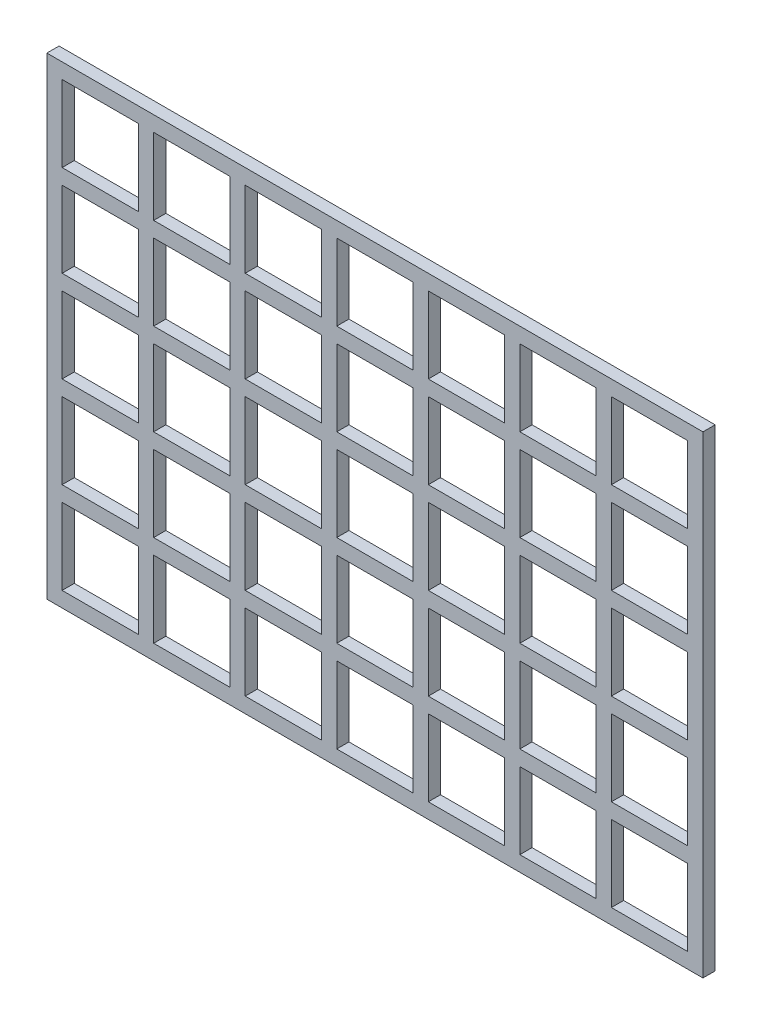
from build123d import *

# Parameters (mm, degrees)
SKETCH_1_W             = 21
SKETCH_1_H             = 0.5
EXTRUDE_1_DEPTH        = 0.4
PATTERN_LINEAR_1_COUNT = 6
PATTERN_LINEAR_1_PITCH = 3
EXTRUDE_3_DEPTH        = 0.4
PATTERN_LINEAR_2_COUNT = 8
PATTERN_LINEAR_2_PITCH = 3


with BuildPart() as part:
    # 草图1 → 凸台-拉伸1 (new body)
    with BuildSketch(Plane.XY):
        with Locations((10.5, 0.25)):
            Rectangle(SKETCH_1_W, SKETCH_1_H)
    extrude(amount=EXTRUDE_1_DEPTH)


with BuildPart() as pattern_linear_1_1:
    # 阵列(线性)1: pattern copy
    add(part.part.moved(Location(Vector(0, 1, 0) * (1 * PATTERN_LINEAR_1_PITCH))))


with BuildPart() as pattern_linear_1_2:
    # 阵列(线性)1: pattern copy
    add(part.part.moved(Location(Vector(0, 1, 0) * (2 * PATTERN_LINEAR_1_PITCH))))


with BuildPart() as pattern_linear_1_3:
    # 阵列(线性)1: pattern copy
    add(part.part.moved(Location(Vector(0, 1, 0) * (3 * PATTERN_LINEAR_1_PITCH))))


with BuildPart() as pattern_linear_1_4:
    # 阵列(线性)1: pattern copy
    add(part.part.moved(Location(Vector(0, 1, 0) * (4 * PATTERN_LINEAR_1_PITCH))))


with BuildPart() as pattern_linear_1_5:
    # 阵列(线性)1: pattern copy
    add(part.part.moved(Location(Vector(0, 1, 0) * (5 * PATTERN_LINEAR_1_PITCH))))


with BuildPart() as part_1:
    add(part.part)

    add(pattern_linear_1_1.part)  # 凸台-拉伸3 merges 阵列(线性)1_1

    add(pattern_linear_1_2.part)  # 凸台-拉伸3 merges 阵列(线性)1_2

    add(pattern_linear_1_3.part)  # 凸台-拉伸3 merges 阵列(线性)1_3
    # 草图3 → 凸台-拉伸3 (add)
    with BuildSketch(Plane.XY.offset(0.4)):
        Polygon((0, 15.5), (0, 9.5), (0, 0), (-0.5, 0), (-0.5, 10.98507125), (-0.5, 15.5), align=None)
    extrude_3 = extrude(amount=-EXTRUDE_3_DEPTH)

    # 阵列(线性)2: 凸台-拉伸3 ×8
    with Locations(*[(i * PATTERN_LINEAR_2_PITCH, 0, 0) for i in range(1, PATTERN_LINEAR_2_COUNT)]):
        add(extrude_3)

    # Combine 1: read off the stored shape, not the designer's step
    # Combine 1: union 阵列(线性)1_4, 阵列(线性)1_5
    add(pattern_linear_1_4.part)
    add(pattern_linear_1_5.part)


solid = part_1.part
